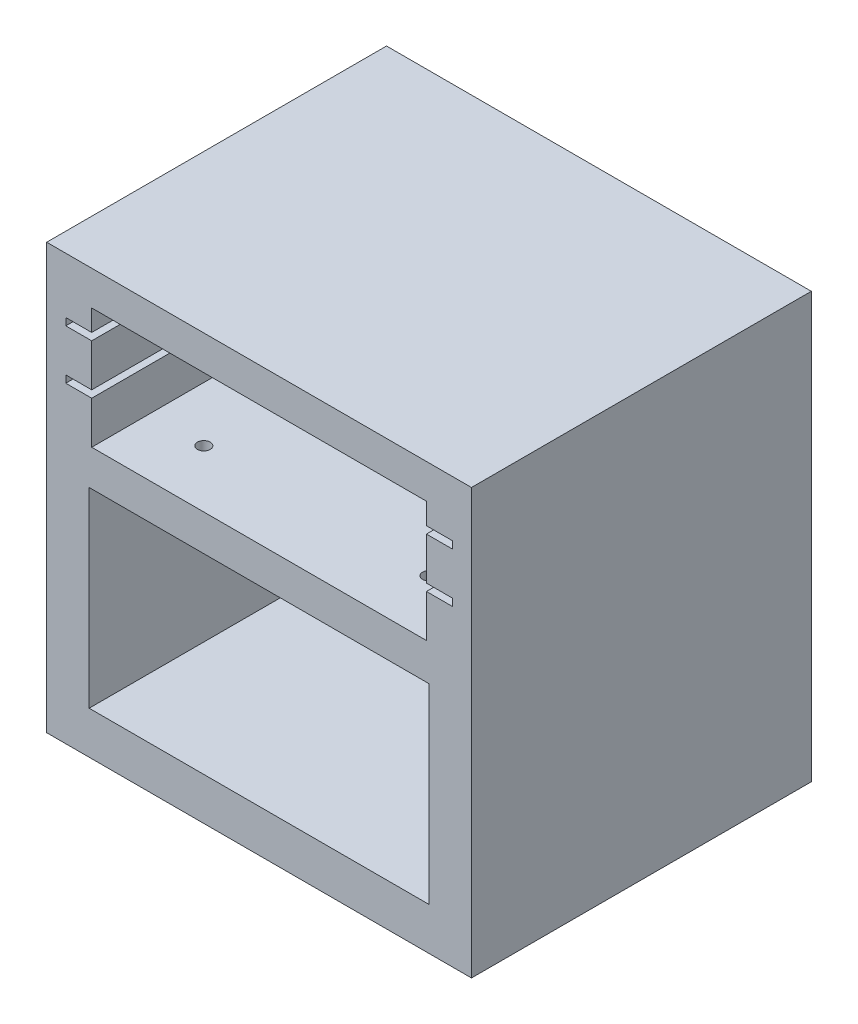
from build123d import *

# Parameters (mm, degrees)
MOUNTING_SKETCH_W   = 100
MOUNTING_SKETCH_H   = 100
MOUNTING_SKETCH_W_2 = 80
MOUNTING_SKETCH_H_2 = 45
BOSS_EXTRUDE3_DEPTH = 40
CUT_EXTRUDE1_REACH  = 86.41
SKETCH10_R          = 2
SKETCH10_R_2        = 1.5


with BuildPart() as part:
    # Mounting Sketch → Boss-Extrude3 (new, symmetric)
    with BuildSketch(Plane.XY):
        Rectangle(MOUNTING_SKETCH_W, MOUNTING_SKETCH_H)
        Polygon((39.4, 41.9), (-39.4, 41.9), (-39.4, 36.9), (-45.5, 36.9), (-45.5, 35.2), (-39.4, 35.2), (-39.4, 25.2), (-45.5, 25.2), (-45.5, 23.5), (-39.4, 23.5), (-39.4, 13.5), (39.4, 13.5), (39.4, 23.5), (45.5, 23.5), (45.5, 25.2), (39.4, 25.2), (39.4, 35.2), (45.5, 35.2), (45.5, 36.9), (39.4, 36.9), align=None, mode=Mode.SUBTRACT)
        with Locations((0, -17.5)):
            Rectangle(MOUNTING_SKETCH_W_2, MOUNTING_SKETCH_H_2, mode=Mode.SUBTRACT)
    extrude(amount=BOSS_EXTRUDE3_DEPTH, both=True)

    # Sketch10 → Cut-Extrude1 (cut, up to next)
    with BuildSketch(Plane.XZ.offset(-5), mode=Mode.PRIVATE) as cut_extrude1_sk1:
        with BuildLine():
            Line((-5, -5.921359641), (-5, -12))
            Line((-5, -12), (5, -12))
            Line((5, -12), (5, -5.921359641))
            ThreePointArc((5, -5.921359641), (0, 7.75), (-5, -5.921359641))
        make_face()
    cut_extrude1_tool1 = extrude(cut_extrude1_sk1.sketch, amount=-CUT_EXTRUDE1_REACH, mode=Mode.PRIVATE) & part.part
    # Sketch10 → Cut-Extrude1 (cut, up to next)
    with BuildSketch(Plane.XZ.offset(-5), mode=Mode.PRIVATE) as cut_extrude1_sk2:
        with Locations((-20.47, 3.74)):
            Circle(SKETCH10_R)
    cut_extrude1_tool2 = extrude(cut_extrude1_sk2.sketch, amount=-CUT_EXTRUDE1_REACH, mode=Mode.PRIVATE) & part.part
    # Sketch10 → Cut-Extrude1 (cut, up to next)
    with BuildSketch(Plane.XZ.offset(-5), mode=Mode.PRIVATE) as cut_extrude1_sk3:
        with Locations((-38.25, -11.5)):
            Circle(SKETCH10_R)
    cut_extrude1_tool3 = extrude(cut_extrude1_sk3.sketch, amount=-CUT_EXTRUDE1_REACH, mode=Mode.PRIVATE) & part.part
    # Sketch10 → Cut-Extrude1 (cut, up to next)
    with BuildSketch(Plane.XZ.offset(-5), mode=Mode.PRIVATE) as cut_extrude1_sk4:
        with Locations((26.5, 26.5)):
            Circle(SKETCH10_R_2)
    cut_extrude1_tool4 = extrude(cut_extrude1_sk4.sketch, amount=-CUT_EXTRUDE1_REACH, mode=Mode.PRIVATE) & part.part
    # Sketch10 → Cut-Extrude1 (cut, up to next)
    with BuildSketch(Plane.XZ.offset(-5), mode=Mode.PRIVATE) as cut_extrude1_sk5:
        with Locations((26.5, -26.5)):
            Circle(SKETCH10_R_2)
    cut_extrude1_tool5 = extrude(cut_extrude1_sk5.sketch, amount=-CUT_EXTRUDE1_REACH, mode=Mode.PRIVATE) & part.part
    # Sketch10 → Cut-Extrude1 (cut, up to next)
    with BuildSketch(Plane.XZ.offset(-5), mode=Mode.PRIVATE) as cut_extrude1_sk6:
        with Locations((-26.5, -26.5)):
            Circle(SKETCH10_R_2)
    cut_extrude1_tool6 = extrude(cut_extrude1_sk6.sketch, amount=-CUT_EXTRUDE1_REACH, mode=Mode.PRIVATE) & part.part
    # Sketch10 → Cut-Extrude1 (cut, up to next)
    with BuildSketch(Plane.XZ.offset(-5), mode=Mode.PRIVATE) as cut_extrude1_sk7:
        with Locations((-26.5, 26.5)):
            Circle(SKETCH10_R_2)
    cut_extrude1_tool7 = extrude(cut_extrude1_sk7.sketch, amount=-CUT_EXTRUDE1_REACH, mode=Mode.PRIVATE) & part.part
    add(cut_extrude1_tool1.solids().sort_by_distance((0, 5, -1.946911))[0], mode=Mode.SUBTRACT)
    add(cut_extrude1_tool2.solids().sort_by_distance((-20.47, 5, 3.74))[0], mode=Mode.SUBTRACT)
    add(cut_extrude1_tool3.solids().sort_by_distance((-38.25, 5, -11.5))[0], mode=Mode.SUBTRACT)
    add(cut_extrude1_tool4.solids().sort_by_distance((26.5, 5, 26.5))[0], mode=Mode.SUBTRACT)
    add(cut_extrude1_tool5.solids().sort_by_distance((26.5, 5, -26.5))[0], mode=Mode.SUBTRACT)
    add(cut_extrude1_tool6.solids().sort_by_distance((-26.5, 5, -26.5))[0], mode=Mode.SUBTRACT)
    add(cut_extrude1_tool7.solids().sort_by_distance((-26.5, 5, 26.5))[0], mode=Mode.SUBTRACT)


solid = part.part
